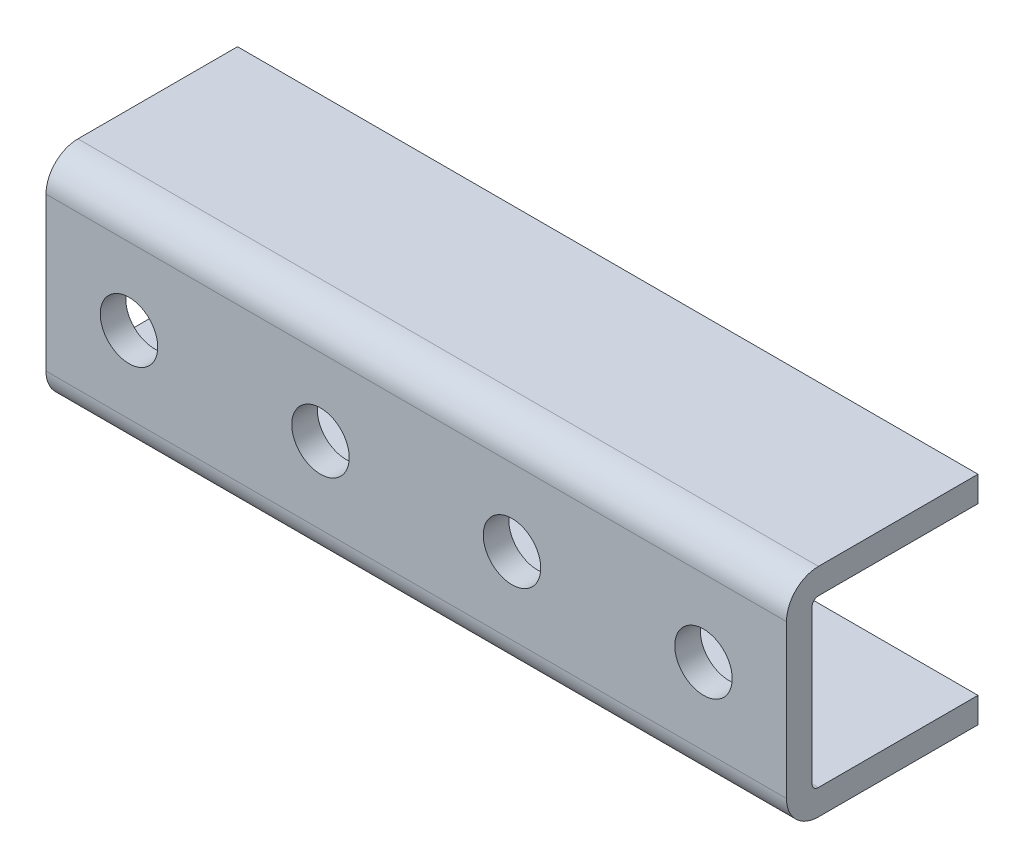
from build123d import *

# Parameters (mm, degrees)
SKETCH1_W           = 184.15
SKETCH1_H           = 53.975
BOSS_EXTRUDE1_DEPTH = 23.8125
FILLET1_R           = 7.9375
SHELL1_T            = -6.35
SKETCH2_R           = 7.14375
CUT_EXTRUDE1_DEPTH  = 47.625


with BuildPart() as part:
    # Sketch1 → Boss-Extrude1 (new, symmetric)
    with BuildSketch(Plane.XY):
        Rectangle(SKETCH1_W, SKETCH1_H)
    extrude(amount=BOSS_EXTRUDE1_DEPTH, both=True)

    # Fillet1
    fillet1_edges = [part.edges().sort_by_distance(p)[0] for p in [
        (0, -26.9875, 23.8125),
        (0, 26.9875, 23.8125),
    ]]
    fillet(fillet1_edges, radius=FILLET1_R)

    # Shell1
    shell1_openings = [part.faces().sort_by_distance(p)[0] for p in [
        (-92.075, 0, -0.234313972),
        (92.075, 0, -0.234313972),
        (0, 0, -23.8125),
    ]]
    offset(amount=SHELL1_T, openings=shell1_openings, kind=Kind.INTERSECTION)

    # Sketch2 → Cut-Extrude1 (cut)
    with BuildSketch(Plane.XY.offset(23.8125)):
        with Locations((-71.4375, 0)):
            Circle(SKETCH2_R)
        with Locations((-23.8125, 0)):
            Circle(SKETCH2_R)
        with Locations((23.8125, 0)):
            Circle(SKETCH2_R)
        with Locations((71.4375, 0)):
            Circle(SKETCH2_R)
    extrude(amount=-CUT_EXTRUDE1_DEPTH, mode=Mode.SUBTRACT)


solid = part.part
